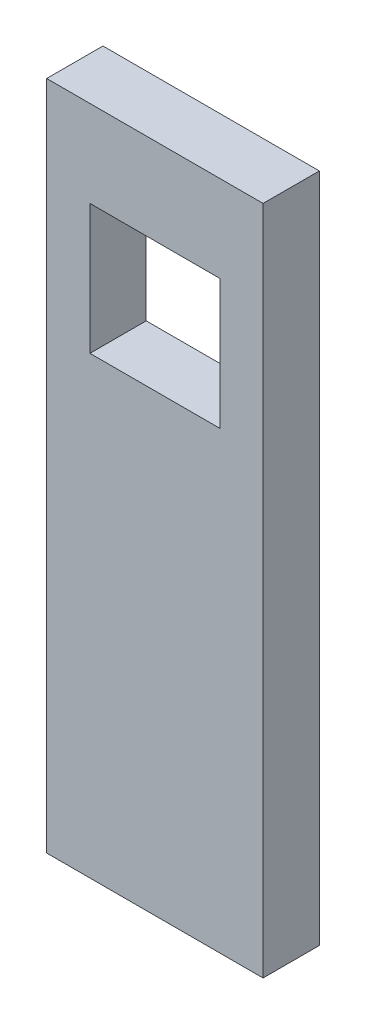
from build123d import *

# Parameters (mm, degrees)
SKETCH1_W           = 12
SKETCH1_H           = 12
BOSS_EXTRUDE1_DEPTH = 2.6


with BuildPart() as part:
    # Sketch1 → Boss-Extrude1 (new, symmetric)
    with BuildSketch(Plane.XY):
        Polygon((0, 62), (0, 42), (0, 37), (0, 25), (0, 20), (0, 0), (20, 0), (20, 20), (20, 25), (20, 37), (20, 42), (20, 62), align=None)
        with Locations((10, 48)):
            Rectangle(SKETCH1_W, SKETCH1_H, mode=Mode.SUBTRACT)
    extrude(amount=BOSS_EXTRUDE1_DEPTH, both=True)


solid = part.part
